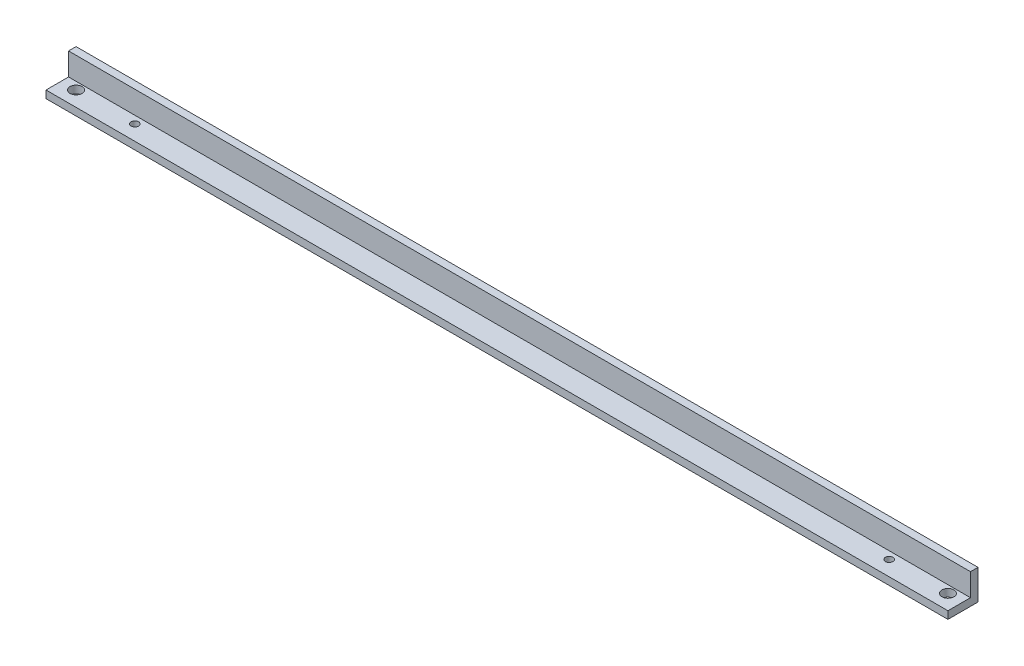
from build123d import *

# Parameters (mm, degrees)
BOSS_EXTRUDE1_DEPTH = 762
SKETCH2_R           = 5.08
SKETCH2_R_2         = 3.175
CUT_EXTRUDE1_DEPTH  = 914.4


with BuildPart() as part:
    # Sketch1 → Boss-Extrude1 (new body)
    with BuildSketch(Plane(origin=(0, 0, 0), x_dir=(0, 0, -1), z_dir=(1, 0, 0))):
        Polygon((0, 0), (0, 19.05), (6.35, 19.05), (6.35, -6.35), (-19.05, -6.35), (-19.05, 0), align=None)
    extrude(amount=BOSS_EXTRUDE1_DEPTH)

    # Sketch2 → Cut-Extrude1 (cut)
    with BuildSketch(Plane.XZ.offset(6.35)):
        with Locations((12.7, 6.35)):
            Circle(SKETCH2_R)
        with Locations((62.357, 6.35)):
            Circle(SKETCH2_R_2)
        with Locations((699.643, 6.35)):
            Circle(SKETCH2_R_2)
        with Locations((749.3, 6.35)):
            Circle(SKETCH2_R)
    extrude(amount=-CUT_EXTRUDE1_DEPTH, mode=Mode.SUBTRACT)


solid = part.part
